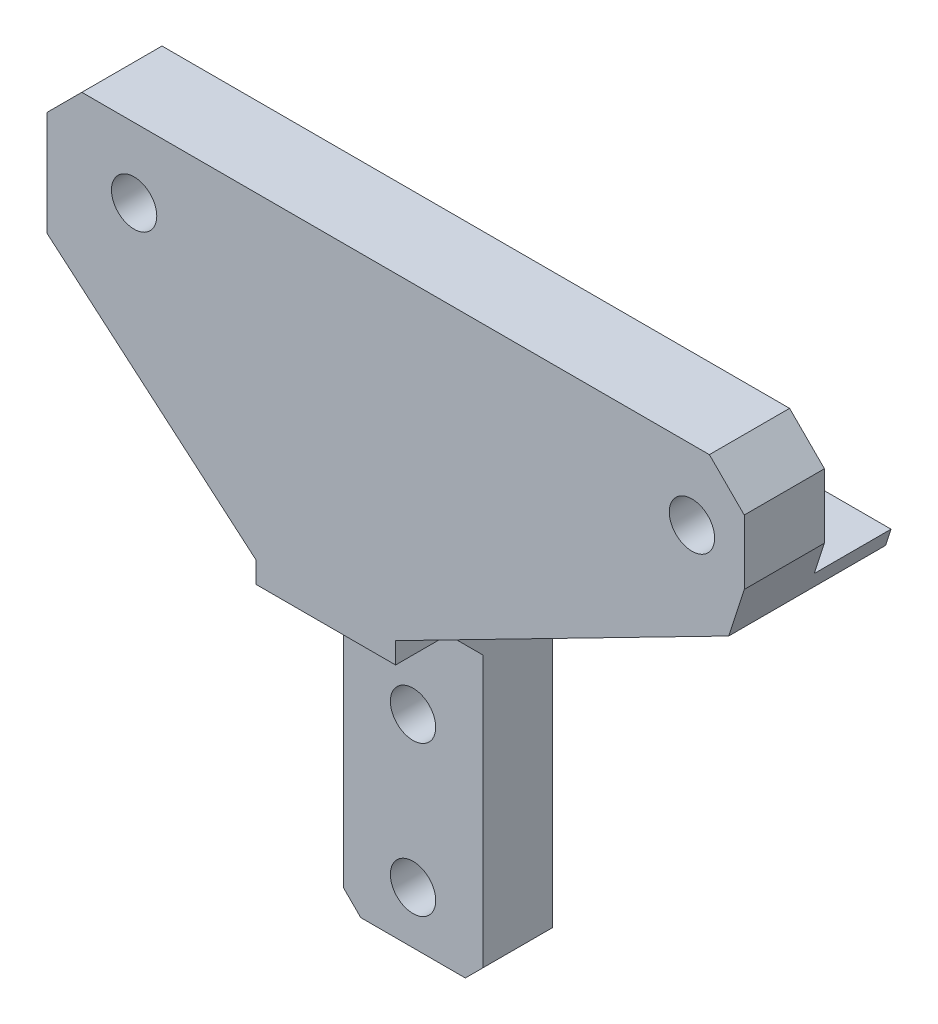
from build123d import *

# Parameters (mm, degrees)
SKETCH_1_R          = 0.65
EXTRUDE_2_DEPTH     = 5.5
CUT_EXTRUDE_START   = 2.5
SKETCH_3_W          = 4
SKETCH_3_H          = 9.274823913
SKETCH_3_R          = 0.65
CUT_EXTRUDE_2_DEPTH = 2.5
CHAMFER_1_SIZE      = 1
CHAMFER_2_SIZE      = 1
CHAMFER_3_SIZE      = 0.5
SKETCH_4_R          = 0.65
CUT_EXTRUDE_3_DEPTH = 3.2
CHAMFER_4_SIZE      = 0.5
CHAMFER_4_SIZE2     = 1.151153621
SKETCH_5_R          = 0.65
CUT_EXTRUDE_4_DEPTH = 1


with BuildPart() as part:
    # 草图1 → 凸台-拉伸2 (new body)
    with BuildSketch(Plane.XY):
        Polygon((-10, 2), (10, 2), (10, -2), (0, -7.120268706), (0, -17), (-4, -17), (-4, -7.120268706), (-10, -2), align=None)
        with Locations((-7.5, 0)):
            Circle(SKETCH_1_R, mode=Mode.SUBTRACT)
        with Locations((8.5, 0)):
            Circle(SKETCH_1_R, mode=Mode.SUBTRACT)
        with Locations((-2, -15.5)):
            Circle(SKETCH_1_R, mode=Mode.SUBTRACT)
        with Locations((-2, -11.2)):
            Circle(SKETCH_1_R, mode=Mode.SUBTRACT)
    extrude(amount=EXTRUDE_2_DEPTH)

    # 草图3 → 切除-拉伸2 (cut)
    with BuildSketch(Plane(origin=(0, 0, 5.5), x_dir=(-1, 0, 0), z_dir=(0, 0, -1)).offset(CUT_EXTRUDE_START)):
        with Locations((2, -12.362588044)):
            Rectangle(SKETCH_3_W, SKETCH_3_H)
        with Locations((2, -15.5)):
            Circle(SKETCH_3_R, mode=Mode.SUBTRACT)
        with Locations((2, -11.2)):
            Circle(SKETCH_3_R, mode=Mode.SUBTRACT)
    extrude(amount=-CUT_EXTRUDE_2_DEPTH, mode=Mode.SUBTRACT)

    # 倒角1
    chamfer_1_edges = [part.edges().sort_by_distance(p)[0] for p in [
        (-2, -7.725176087, 3),
    ]]
    chamfer(chamfer_1_edges, length=CHAMFER_1_SIZE)

    # 倒角2
    chamfer_2_edges = [part.edges().sort_by_distance(p)[0] for p in [
        (-10, 2, 2.75),
        (10, 2, 2.75),
    ]]
    chamfer(chamfer_2_edges, length=CHAMFER_2_SIZE)

    # 倒角3
    chamfer_3_edges = [part.edges().sort_by_distance(p)[0] for p in [
        (-4, -17, 1.5),
        (0, -17, 1.5),
    ]]
    chamfer(chamfer_3_edges, length=CHAMFER_3_SIZE)

    # 草图4 → 切除-拉伸3 (cut)
    with BuildSketch(Plane.XY):
        Polygon((-10, -1.746172146), (10, -1.746172146), (10, 1), (9, 2), (-9, 2), (-10, 1), align=None)
        with Locations((8.5, 0)):
            Circle(SKETCH_4_R, mode=Mode.SUBTRACT)
        with Locations((-7.5, 0)):
            Circle(SKETCH_4_R, mode=Mode.SUBTRACT)
    extrude(amount=CUT_EXTRUDE_3_DEPTH, mode=Mode.SUBTRACT)

    # 倒角4
    chamfer_4_edges = [part.edges().sort_by_distance(p)[0] for p in [
        (10, -2, 2.75),
    ]]
    chamfer_4_side = [part.faces().sort_by_distance(p)[0] for p in [
        (5, -4.560134353, 2.75),
    ]]
    chamfer(chamfer_4_edges, length=CHAMFER_4_SIZE, length2=CHAMFER_4_SIZE2, reference=chamfer_4_side[0])

    # 草图5 → 切除-拉伸4 (cut)
    with BuildSketch(Plane(origin=(0, 0, 0), x_dir=(-1, 0, 0), z_dir=(0, 0, -1))):
        with Locations((7.5, 0)):
            Circle(SKETCH_5_R)
        with Locations((-8.5, 0)):
            Circle(SKETCH_5_R)
        Polygon((-9.710408015, -1.746172146), (-9.554947939, -2.227878614), (0, -7.120268706), (0, -16.5), (0.5, -17), (3.5, -17), (4, -16.5), (4, -7.120268706), (10, -2), (10, -1.746172146), align=None)
    extrude(amount=-CUT_EXTRUDE_4_DEPTH, mode=Mode.SUBTRACT)


solid = part.part
